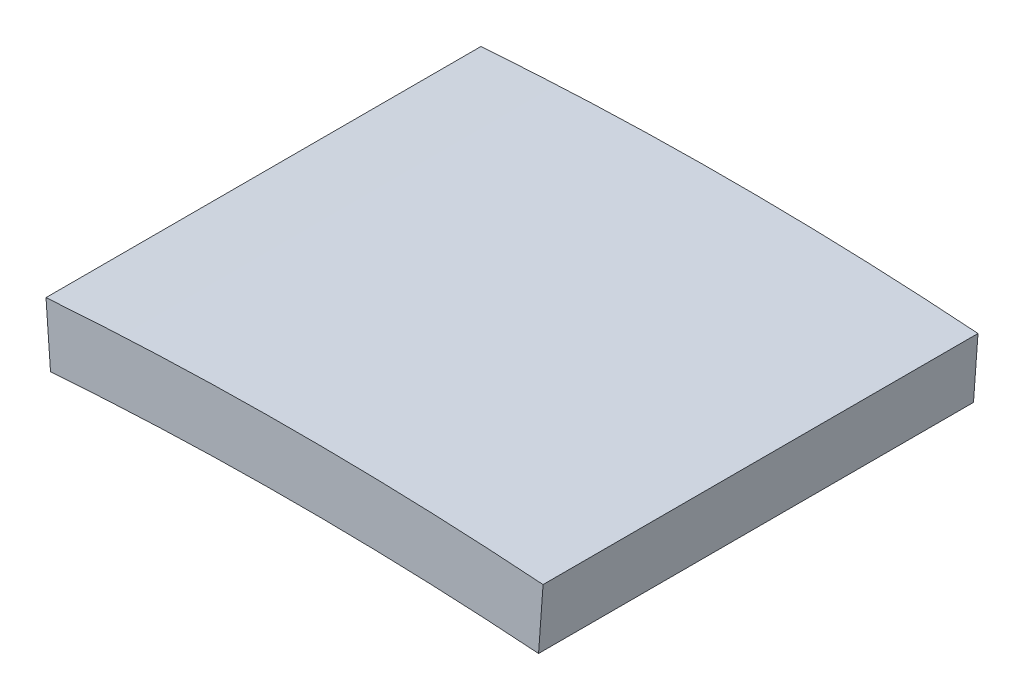
from build123d import *

# Parameters (mm, degrees)
SM_BASE_FLANGE_1_DEPTH = 70


# Sheet-metal steps are written as plain solids
with BuildPart() as part:
    # Sketch 2 → 基体-法兰1 (new body)
    with BuildSketch(Plane.XY):
        with BuildLine():
            ThreePointArc((40, 549.546176404), (0, 551), (-40, 549.546176404))
            Line((-40, 549.546176404), (-39.274047187, 539.572561587))
            ThreePointArc((-39.274047187, 539.572561587), (0, 541), (39.274047187, 539.572561587))
            Line((39.274047187, 539.572561587), (40, 549.546176404))
        make_face()
    extrude(amount=SM_BASE_FLANGE_1_DEPTH)


solid = part.part
